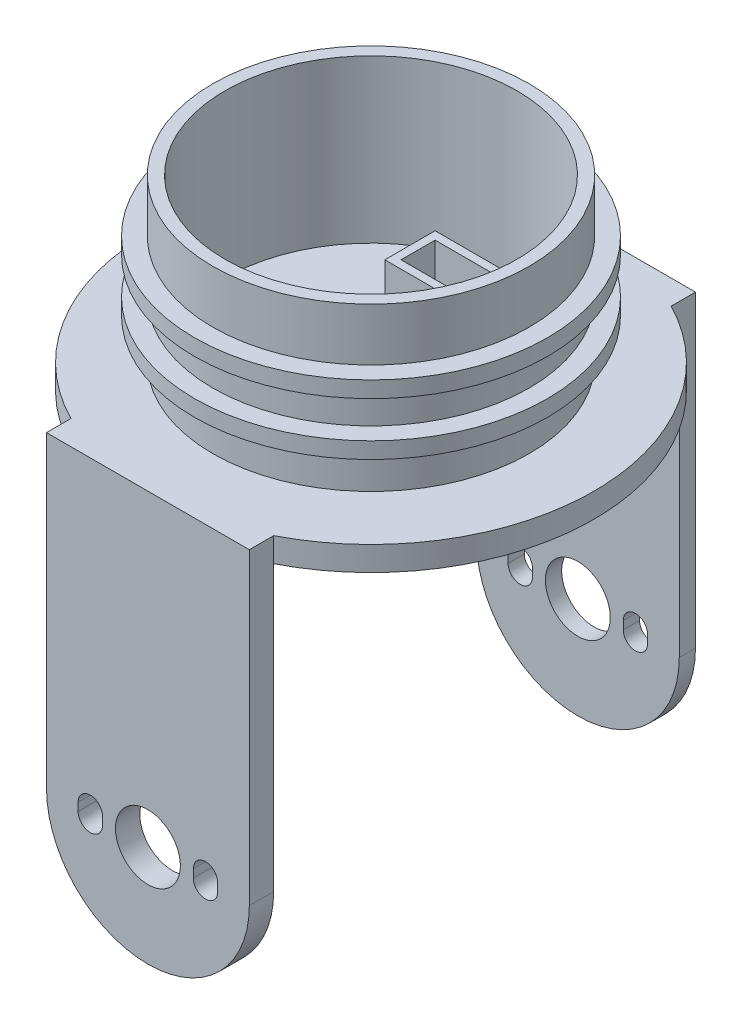
from build123d import *

# Parameters (mm, degrees)
SKETCH_1_R          = 19.5
SKETCH_1_R_2        = 18
EXTRUDE_1_DEPTH     = 20
SKETCH_3_R          = 27.5
EXTRUDE_2_DEPTH     = 3
EXTRUDE_START       = 2
SKETCH_25_R         = 21.75
SKETCH_25_R_2       = 19.5
EXTRUDE_12_DEPTH    = 2
EXTRUDE_START_2     = -1
SKETCH_26_R         = 21.75
SKETCH_26_R_2       = 19.5
EXTRUDE_13_DEPTH    = 2
SKETCH_27_W         = 25
SKETCH_27_H         = 51
EXTRUDE_14_DEPTH    = 3
SKETCH_28_R         = 4
EXTRUDE_17_DEPTH    = 2
EXTRUDE_START_3     = -53
SKETCH_28_15_R      = 4
EXTRUDE_19_DEPTH    = 53
SKETCH_32_W         = 2.204369859
SKETCH_32_H         = 3
EXTRUDE_20_DEPTH    = 2
CUT_EXTRUDE_START   = -50
SKETCH_28_18_R      = 4
CUT_EXTRUDE_8_DEPTH = 50
SKETCH_33_W         = 25
SKETCH_33_H         = 3
EXTRUDE_21_DEPTH    = 3
SKETCH_34_W         = 10.2
SKETCH_34_H         = 6.2
SKETCH_34_W_2       = 8.2
SKETCH_34_H_2       = 4.2
EXTRUDE_22_DEPTH    = 5
SKETCH_37_W         = 8.2
SKETCH_37_H         = 4.2
CUT_EXTRUDE_9_DEPTH = 5


with BuildPart() as part:
    # 草圖1 → 填料-伸長1 (new body)
    with BuildSketch(Plane(origin=(0, 0, 0), x_dir=(1, 0, 0), z_dir=(0, 1, 0))):
        Circle(SKETCH_1_R)
        Circle(SKETCH_1_R_2, mode=Mode.SUBTRACT)
    extrude(amount=EXTRUDE_1_DEPTH)

    # 草圖3 → 填料-伸長2 (add)
    with BuildSketch(Plane.XZ):
        Circle(SKETCH_3_R)
    extrude(amount=EXTRUDE_2_DEPTH)

    # 草圖25 → 填料-伸長12 (add)
    with BuildSketch(Plane(origin=(0, 7, 0), x_dir=(-1, 0, 0), z_dir=(0, -1, 0)).offset(EXTRUDE_START)):
        Circle(SKETCH_25_R)
        Circle(SKETCH_25_R_2, mode=Mode.SUBTRACT)
    extrude(amount=-EXTRUDE_12_DEPTH)

    # 草圖26 → 填料-伸長13 (add)
    with BuildSketch(Plane(origin=(0, 10.5, 0), x_dir=(-1, 0, 0), z_dir=(0, -1, 0)).offset(EXTRUDE_START_2)):
        Circle(SKETCH_26_R)
        Circle(SKETCH_26_R_2, mode=Mode.SUBTRACT)
    extrude(amount=-EXTRUDE_13_DEPTH)

    # 草圖27 → 填料-伸長14 (add)
    with BuildSketch(Plane.XZ.offset(3)):
        Rectangle(SKETCH_27_W, SKETCH_27_H)
    extrude(amount=-EXTRUDE_14_DEPTH)

    # 草圖28 → 填料-伸長17 (add)
    with BuildSketch(Plane(origin=(0, 0, -25.5), x_dir=(-1, 0, 0), z_dir=(0, 0, -1))):
        with BuildLine():
            Line((12.5, 0), (-12.5, 0))
            Line((-12.5, 0), (-12.5, -38))
            ThreePointArc((-12.5, -38), (0, -50.5), (12.5, -38))
            Line((12.5, -38), (12.5, 0))
        make_face()
        with BuildLine():
            Line((8.6, -37.5), (8.6, -38.5))
            ThreePointArc((8.6, -38.5), (7.1, -40), (5.6, -38.5))
            Line((5.6, -38.5), (5.6, -37.5))
            ThreePointArc((5.6, -37.5), (7.1, -36), (8.6, -37.5))
        make_face(mode=Mode.SUBTRACT)
        with Locations((0, -38)):
            Circle(SKETCH_28_R, mode=Mode.SUBTRACT)
        with BuildLine():
            Line((-5.6, -37.5), (-5.6, -38.5))
            ThreePointArc((-5.6, -38.5), (-7.1, -40), (-8.6, -38.5))
            Line((-8.6, -38.5), (-8.6, -37.5))
            ThreePointArc((-8.6, -37.5), (-7.1, -36), (-5.6, -37.5))
        make_face(mode=Mode.SUBTRACT)
    extrude(amount=EXTRUDE_17_DEPTH)

    # 草圖28<15> → 填料-伸長19 (add)
    with BuildSketch(Plane(origin=(0, 0, -25.5), x_dir=(-1, 0, 0), z_dir=(0, 0, -1)).offset(EXTRUDE_START_3)):
        with BuildLine():
            Line((12.5, -38), (12.5, -3))
            Line((12.5, -3), (-12.5, -3))
            Line((-12.5, -3), (-12.5, -38))
            ThreePointArc((-12.5, -38), (0, -50.5), (12.5, -38))
        make_face()
        with BuildLine():
            Line((8.6, -37.5), (8.6, -38.5))
            ThreePointArc((8.6, -38.5), (7.1, -40), (5.6, -38.5))
            Line((5.6, -38.5), (5.6, -37.5))
            ThreePointArc((5.6, -37.5), (7.1, -36), (8.6, -37.5))
        make_face(mode=Mode.SUBTRACT)
        with Locations((0, -38)):
            Circle(SKETCH_28_15_R, mode=Mode.SUBTRACT)
        with BuildLine():
            Line((-5.6, -37.5), (-5.6, -38.5))
            ThreePointArc((-5.6, -38.5), (-7.1, -40), (-8.6, -38.5))
            Line((-8.6, -38.5), (-8.6, -37.5))
            ThreePointArc((-8.6, -37.5), (-7.1, -36), (-5.6, -37.5))
        make_face(mode=Mode.SUBTRACT)
    extrude(amount=EXTRUDE_19_DEPTH)

    # 草圖32 → 填料-伸長20 (add)
    with BuildSketch(Plane.XY.offset(25.5)):
        with Locations((11.397815071, -1.5)):
            Rectangle(SKETCH_32_W, SKETCH_32_H)
        with Locations((-11.397815071, -1.5)):
            Rectangle(SKETCH_32_W, SKETCH_32_H)
    extrude(amount=EXTRUDE_20_DEPTH)

    # 草圖28<18> → 除料-伸長8 (cut)
    with BuildSketch(Plane(origin=(0, 0, -25.5), x_dir=(-1, 0, 0), z_dir=(0, 0, -1)).offset(CUT_EXTRUDE_START)):
        with BuildLine():
            Line((12.5, -38), (12.5, -3))
            Line((12.5, -3), (-12.5, -3))
            Line((-12.5, -3), (-12.5, -38))
            ThreePointArc((-12.5, -38), (0, -50.5), (12.5, -38))
        make_face()
        with BuildLine():
            Line((8.6, -37.5), (8.6, -38.5))
            ThreePointArc((8.6, -38.5), (7.1, -40), (5.6, -38.5))
            Line((5.6, -38.5), (5.6, -37.5))
            ThreePointArc((5.6, -37.5), (7.1, -36), (8.6, -37.5))
        make_face(mode=Mode.SUBTRACT)
        with Locations((0, -38)):
            Circle(SKETCH_28_18_R, mode=Mode.SUBTRACT)
        with BuildLine():
            Line((-5.6, -37.5), (-5.6, -38.5))
            ThreePointArc((-5.6, -38.5), (-7.1, -40), (-8.6, -38.5))
            Line((-8.6, -38.5), (-8.6, -37.5))
            ThreePointArc((-8.6, -37.5), (-7.1, -36), (-5.6, -37.5))
        make_face(mode=Mode.SUBTRACT)
    extrude(amount=CUT_EXTRUDE_8_DEPTH, mode=Mode.SUBTRACT)

    # 草圖33 → 填料-伸長21 (add)
    with BuildSketch(Plane.XY.offset(27.5)):
        with Locations((0, -1.5)):
            Rectangle(SKETCH_33_W, SKETCH_33_H)
    extrude(amount=-EXTRUDE_21_DEPTH)

    # 草圖34 → 填料-伸長22 (add)
    with BuildSketch(Plane(origin=(0, 0, 0), x_dir=(1, 0, 0), z_dir=(0, 1, 0))):
        with Locations((0, 9.9)):
            Rectangle(SKETCH_34_W, SKETCH_34_H)
        with Locations((0, 9.9)):
            Rectangle(SKETCH_34_W_2, SKETCH_34_H_2, mode=Mode.SUBTRACT)
    extrude(amount=EXTRUDE_22_DEPTH)

    # 草圖37 → 除料-伸長9 (cut)
    with BuildSketch(Plane(origin=(0, 0, 0), x_dir=(1, 0, 0), z_dir=(0, 1, 0))):
        with Locations((0, 9.9)):
            Rectangle(SKETCH_37_W, SKETCH_37_H)
    extrude(amount=-CUT_EXTRUDE_9_DEPTH, mode=Mode.SUBTRACT)


solid = part.part
